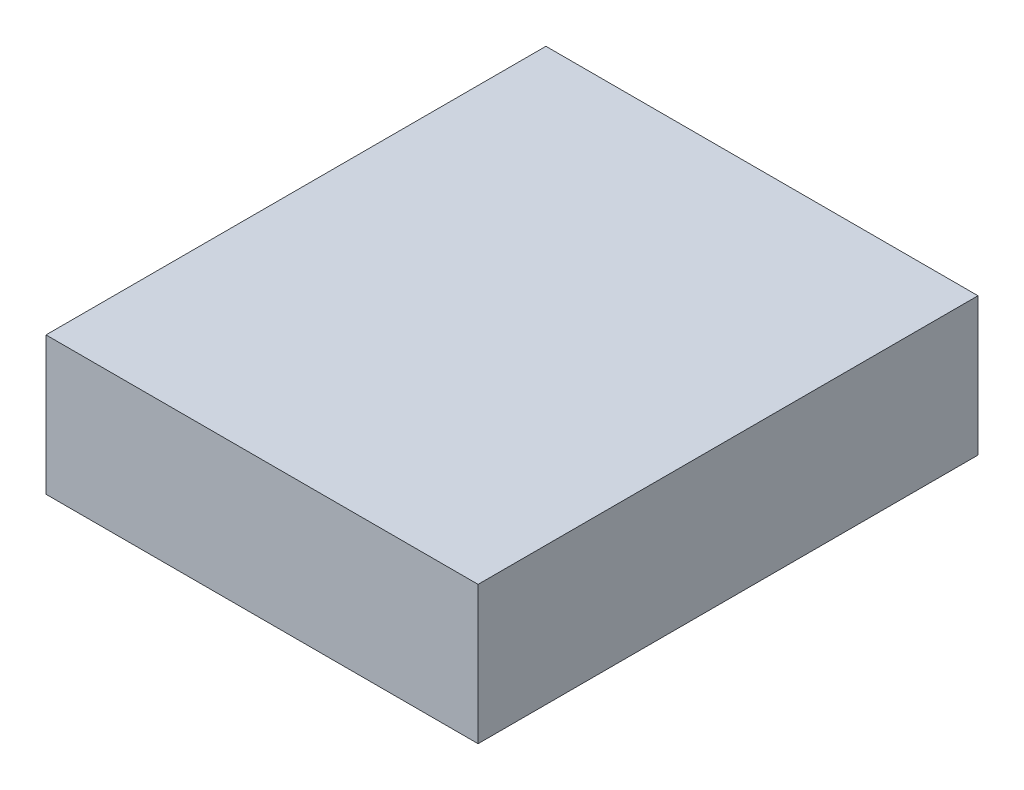
from build123d import *

# Parameters (mm, degrees)
SKETCH1_W           = 31.30472038
SKETCH1_H           = 36.22033763
BOSS_EXTRUDE1_DEPTH = 10


with BuildPart() as part:
    # Sketch1 → Boss-Extrude1 (new body)
    with BuildSketch(Plane(origin=(0, 0, 0), x_dir=(1, 0, 0), z_dir=(0, 1, 0))):
        Rectangle(SKETCH1_W, SKETCH1_H)
    extrude(amount=BOSS_EXTRUDE1_DEPTH)


solid = part.part
